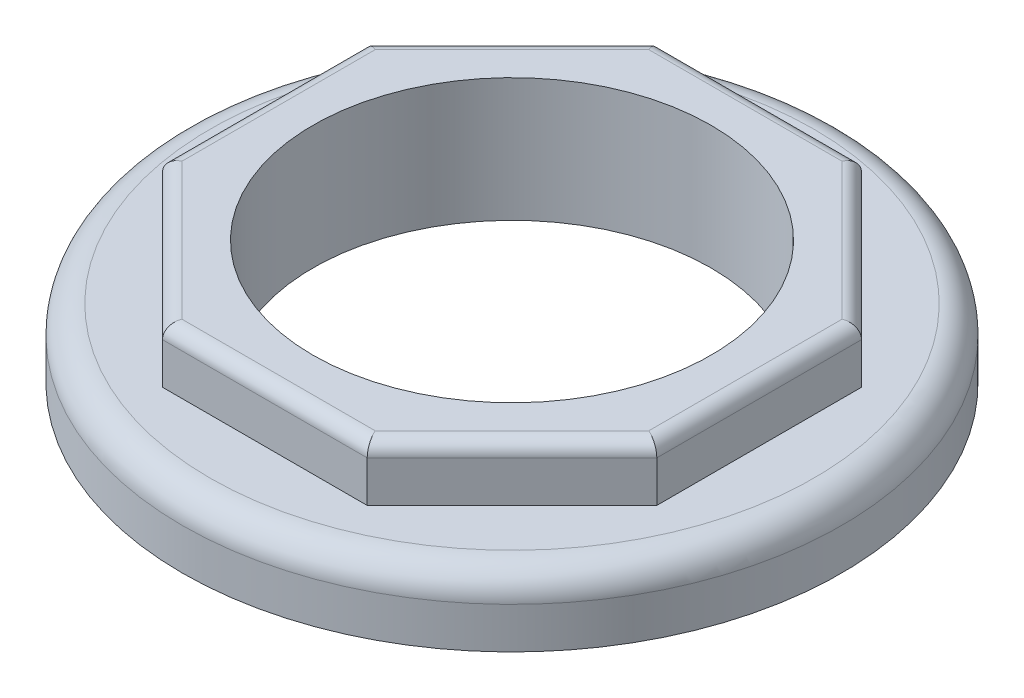
from build123d import *

# Parameters (mm, degrees)
SALIENTE_EXTRUIR1_DEPTH = 9
CROQUIS2_R              = 14.5
CORTAR_EXTRUIR1_DEPTH   = 28
REDONDEO1_R             = 1
CROQUIS4_R              = 24
SALIENTE_EXTRUIR2_DEPTH = 5
CROQUIS5_R              = 14.5
CORTAR_EXTRUIR2_DEPTH   = 35.307433597
REDONDEO2_R             = 2
VACIADO1_OUTLINE_R      = 23
VACIADO1_OUTLINE_R_2    = 15.5
VACIADO1_DEPTH          = 2.9999999
VACIADO1_2_OUTLINE_R    = 15.5
VACIADO1_2_DEPTH        = 8


with BuildPart() as part:
    # Croquis1 → Saliente-Extruir1 (new body)
    with BuildSketch(Plane(origin=(0, 0, 0), x_dir=(1, 0, 0), z_dir=(0, 1, 0))):
        Polygon((18, 7.455844123), (7.455844123, 18), (-7.455844123, 18), (-18, 7.455844123), (-18, -7.455844123), (-7.455844123, -18), (7.455844123, -18), (18, -7.455844123), align=None)
    extrude(amount=SALIENTE_EXTRUIR1_DEPTH)

    # Croquis2 → Cortar-Extruir1 (cut, through all)
    with BuildSketch(Plane(origin=(0, 9, 0), x_dir=(1, 0, 0), z_dir=(0, 1, 0))):
        with Locations(Location((0, 0, 0), (0, 0, 270))):
            Circle(CROQUIS2_R)
    extrude(amount=-CORTAR_EXTRUIR1_DEPTH, mode=Mode.SUBTRACT)

    # Redondeo1
    redondeo1_edges = [part.edges().sort_by_distance(p)[0] for p in [
        (0, 9, -18),
        (-12.727922061, 9, -12.727922061),
        (-18, 9, 0),
        (-12.727922061, 9, 12.727922061),
        (0, 9, 18),
        (12.727922061, 9, 12.727922061),
        (18, 9, 0),
        (12.727922061, 9, -12.727922061),
    ]]
    fillet(redondeo1_edges, radius=REDONDEO1_R)

    # Croquis4 → Saliente-Extruir2 (add)
    with BuildSketch(Plane(origin=(0, 5, 0), x_dir=(1, 0, 0), z_dir=(0, 1, 0))):
        with Locations(Location((0, 0, 0), (0, 0, 270))):
            Circle(CROQUIS4_R)
    extrude(amount=-SALIENTE_EXTRUIR2_DEPTH)

    # Croquis5 → Cortar-Extruir2 (cut, through all)
    with BuildSketch(Plane(origin=(0, 5, 0), x_dir=(1, 0, 0), z_dir=(0, 1, 0))):
        with Locations(Location((0, 0, 0), (0, 0, 270))):
            Circle(CROQUIS5_R)
    extrude(amount=-CORTAR_EXTRUIR2_DEPTH, mode=Mode.SUBTRACT)

    # Redondeo2
    redondeo2_edges = [part.edges().sort_by_distance(p)[0] for p in [
        (0, 5, -24),
    ]]
    fillet(redondeo2_edges, radius=REDONDEO2_R)

    # Vaciado1: read off the stored shape, not the designer's step
    # Vaciado1 outline → Vaciado1 (cut)
    with BuildSketch(Plane(origin=(0, 0, 0), x_dir=(1, 0, 0), z_dir=(0, 1, 0))):
        Circle(VACIADO1_OUTLINE_R)
        Circle(VACIADO1_OUTLINE_R_2, mode=Mode.SUBTRACT)
    extrude(amount=VACIADO1_DEPTH, mode=Mode.SUBTRACT)

    # Vaciado1 2 outline → Vaciado1 2 (cut)
    with BuildSketch(Plane(origin=(0, 0, 0), x_dir=(1, 0, 0), z_dir=(0, 1, 0))):
        Polygon((17, -7.04163056), (17, 7.04163056), (7.04163056, 17), (-7.04163056, 17), (-17, 7.04163056), (-17, -7.04163056), (-7.04163056, -17), (7.04163056, -17), align=None)
        Circle(VACIADO1_2_OUTLINE_R, mode=Mode.SUBTRACT)
    extrude(amount=VACIADO1_2_DEPTH, mode=Mode.SUBTRACT)

    # Vaciado1 3 outline → Vaciado1 3 (revolve, cut)
    with BuildSketch(Plane.XY):
        with BuildLine():
            Line((17, 2.9999999), (23, 3))
            ThreePointArc((23, 3), (22.707106781, 3.707106781), (22, 4))
            Line((22, 4), (17, 4))
            Line((17, 4), (17, 2.9999999))
        make_face()
    revolve(axis=Axis((0, 0, 0), (0, 1, 0)), mode=Mode.SUBTRACT)


solid = part.part
